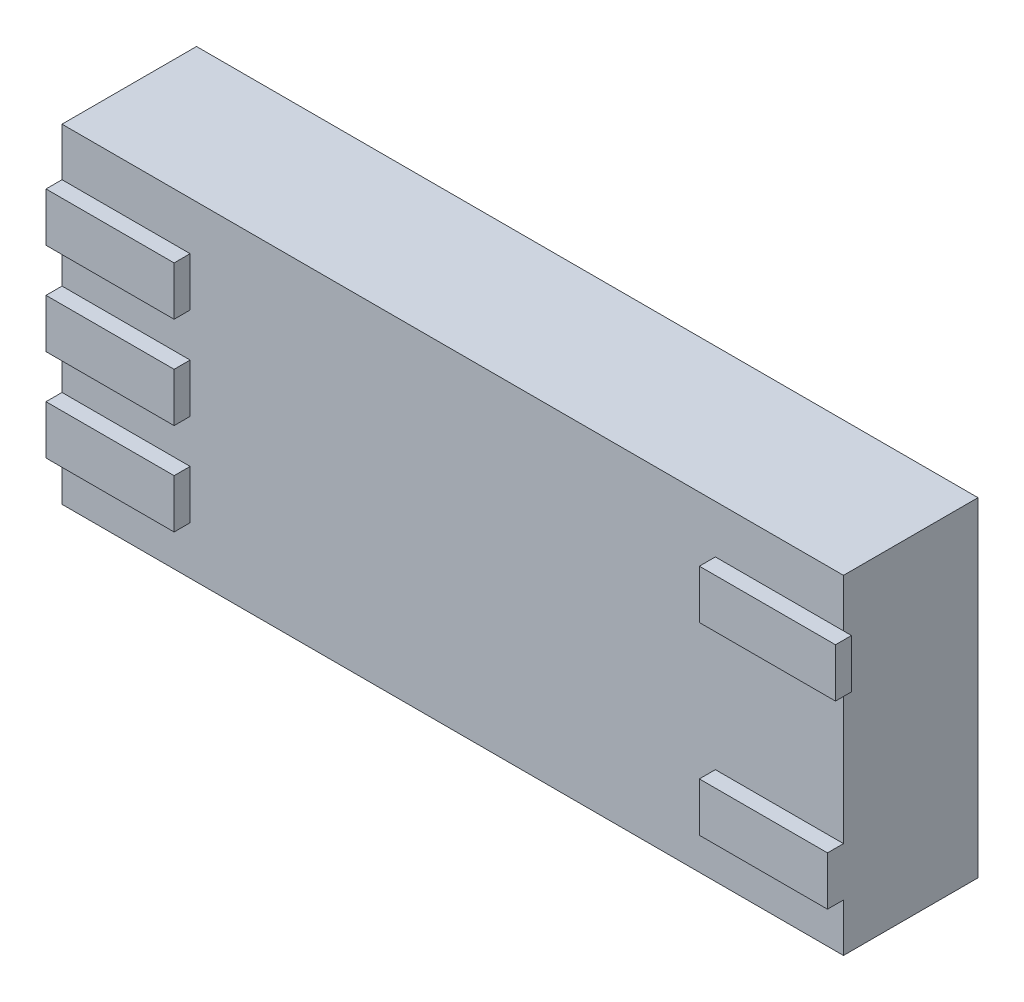
from build123d import *

# Parameters (mm, degrees)
SKETCH1_W           = 61.976
SKETCH1_H           = 26.1112
BOSS_EXTRUDE1_DEPTH = 10.668
SKETCH2_W           = 10.16
SKETCH2_H           = 3.869870213
SKETCH2_H_2         = 3.869870212
BOSS_EXTRUDE2_DEPTH = 1.27
SKETCH3_W           = 1.27
SKETCH3_H           = 3.869870213
BOSS_EXTRUDE3_DEPTH = 0.635


with BuildPart() as part:
    # Sketch1 → Boss-Extrude1 (new body)
    with BuildSketch(Plane.XY):
        with Locations((30.988, 13.0556)):
            Rectangle(SKETCH1_W, SKETCH1_H)
    extrude(amount=BOSS_EXTRUDE1_DEPTH)

    # Sketch2 → Boss-Extrude2 (add)
    with BuildSketch(Plane.XY.offset(10.668)):
        with Locations((5.08, 5.750232763)):
            Rectangle(SKETCH2_W, SKETCH2_H)
        with Locations((5.08, 13.0556)):
            Rectangle(SKETCH2_W, SKETCH2_H_2)
        with Locations((5.08, 20.360967237)):
            Rectangle(SKETCH2_W, SKETCH2_H)
        with Locations((56.896, 5.750232763)):
            Rectangle(SKETCH2_W, SKETCH2_H)
        with Locations((56.896, 20.360967237)):
            Rectangle(SKETCH2_W, SKETCH2_H)
    extrude(amount=BOSS_EXTRUDE2_DEPTH)

    # Sketch3 → Boss-Extrude3 (add)
    with BuildSketch(Plane(origin=(61.976, 0, 0), x_dir=(0, 0, -1), z_dir=(1, 0, 0))):
        with Locations((-11.303, 20.360967237)):
            Rectangle(SKETCH3_W, SKETCH3_H)
    extrude(amount=BOSS_EXTRUDE3_DEPTH)


solid = part.part
